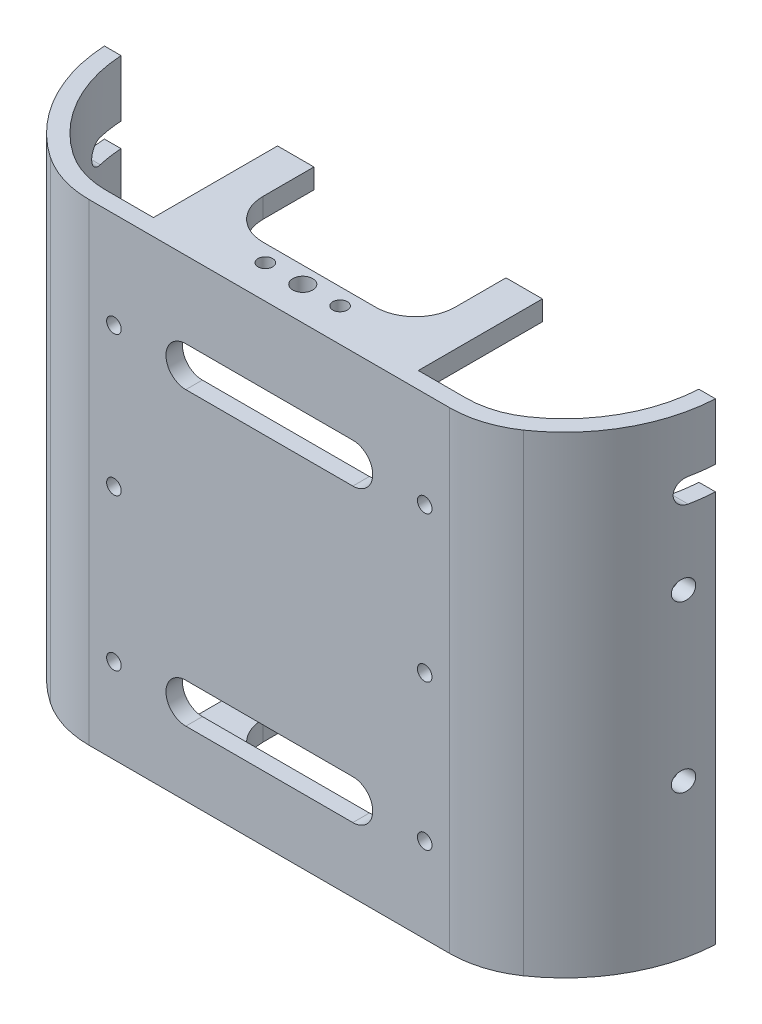
from build123d import *
from build123d.topology import SkipClean

# Parameters (mm, degrees)
EXTRUDE_1_OUTLINE_W          = 93.5
EXTRUDE_1_OUTLINE_H          = 72
EXTRUDE_1_OUTLINE_R          = 1.6
EXTRUDE_1_DEPTH              = 2.5
SKETCH_13_R                  = 4
CUT_EXTRUDE_7_DEPTH          = 1
SKETCH_14_W                  = 93.5
SKETCH_14_H                  = 3
EXTRUDE_4_DEPTH              = 22.5
EXTRUDE_4_2_DEPTH            = 22.5
CUT_EXTRUDE_9_DEPTH          = 1404.749841307
CUT_EXTRUDE_9_DEPTH_BACK     = 1404.749841307
SKETCH_17_R                  = 3.4
EXTRUDE_5_DEPTH              = 3.5
EXTRUDE_5_2_DEPTH            = 3.5
EXTRUDE_5_3_DEPTH            = 3.5
EXTRUDE_5_4_DEPTH            = 3.5
EXTRUDE_5_5_DEPTH            = 3.5
EXTRUDE_5_6_DEPTH            = 3.5
CUT_EXTRUDE_START            = -81.5
CUT_EXTRUDE_11_OUTLINE_R     = 1.5
CUT_EXTRUDE_11_OUTLINE_R_2   = 1.1
CUT_EXTRUDE_11_DEPTH         = 85
FILLET_1_R                   = 15
FILLET_2_R                   = 15
EXTRUDE_START                = -75
EXTRUDE_6_DEPTH              = 75
CUT_EXTRUDE_START_2          = -20
CUT_EXTRUDE_12_OUTLINE_W     = 95
CUT_EXTRUDE_12_OUTLINE_H     = 85
CUT_EXTRUDE_12_DEPTH         = 23.761113625
CUT_EXTRUDE_START_3          = 3.761113625
CUT_EXTRUDE_12_2_OUTLINE_W   = 95
CUT_EXTRUDE_12_2_OUTLINE_H   = 6.849216222
CUT_EXTRUDE_12_2_OUTLINE_H_2 = 6.781336254
CUT_EXTRUDE_12_2_DEPTH       = 21.238886375
SKETCH_25_W                  = 40
SKETCH_25_H                  = 3
EXTRUDE_8_DEPTH              = 18.738886375
CUT_EXTRUDE_13_DEPTH         = 1403.7807385
CUT_EXTRUDE_13_DEPTH_BACK    = 1403.7807385
SKETCH_27_R                  = 1.1
SKETCH_27_R_2                = 1.5
CUT_EXTRUDE_14_DEPTH         = 843.111636683
CUT_EXTRUDE_14_DEPTH_BACK    = 843.111636683
SKETCH_28_R                  = 1.5
SKETCH_29_R                  = 1.1
CUT_EXTRUDE_15_DEPTH         = 10


# Read off the part's stored shape, not the designer's step: 凸台-拉伸1, 切除-拉伸11, 切除-拉伸12
with BuildPart() as part:
    # 凸台-拉伸1 outline → 凸台-拉伸1 (new body)
    with BuildSketch(Plane.XY):
        with Locations((1354.608133016, -704.50677594)):
            Rectangle(EXTRUDE_1_OUTLINE_W, EXTRUDE_1_OUTLINE_H)
        with Locations((1327.358133016, -728.00677594)):
            Circle(EXTRUDE_1_OUTLINE_R, mode=Mode.SUBTRACT)
        with Locations((1328.858133016, -716.50677594)):
            Circle(EXTRUDE_1_OUTLINE_R, mode=Mode.SUBTRACT)
        with Locations((1385.858133016, -728.00677594)):
            Circle(EXTRUDE_1_OUTLINE_R, mode=Mode.SUBTRACT)
        with Locations((1368.858133016, -716.50677594)):
            Circle(EXTRUDE_1_OUTLINE_R, mode=Mode.SUBTRACT)
        with Locations((1328.858133016, -692.50677594)):
            Circle(EXTRUDE_1_OUTLINE_R, mode=Mode.SUBTRACT)
        with Locations((1327.358133016, -679.00677594)):
            Circle(EXTRUDE_1_OUTLINE_R, mode=Mode.SUBTRACT)
        with Locations((1368.858133016, -692.50677594)):
            Circle(EXTRUDE_1_OUTLINE_R, mode=Mode.SUBTRACT)
        with Locations((1385.858133016, -679.00677594)):
            Circle(EXTRUDE_1_OUTLINE_R, mode=Mode.SUBTRACT)
    extrude(amount=EXTRUDE_1_DEPTH)

    # 草图13 → 切除-拉伸7 (cut)
    with BuildSketch(Plane.XY.offset(2.5)):
        with Locations((1368.858133016, -692.50677594)):
            Circle(SKETCH_13_R)
        with Locations((1368.858133016, -716.50677594)):
            Circle(SKETCH_13_R)
        with Locations((1328.858133016, -716.50677594)):
            Circle(SKETCH_13_R)
        with Locations((1328.858133016, -692.50677594)):
            Circle(SKETCH_13_R)
    extrude(amount=-CUT_EXTRUDE_7_DEPTH, mode=Mode.SUBTRACT)

    # 草图15 → 切除-拉伸9 (cut, two sides: drawn at the far end of the back side and taken through both)
    with BuildSketch(Plane.XZ.offset(743.50677594).offset(-CUT_EXTRUDE_9_DEPTH_BACK)):
        with BuildLine():
            Line((1316.26340276, 25), (1300.368331244, 25))
            Line((1300.368331244, 25), (1300.368331244, -20))
            Line((1300.368331244, -20), (1316.26340276, -20))
            ThreePointArc((1316.26340276, -20), (1308.362775025, 2.5), (1316.26340276, 25))
        make_face()
        with BuildLine():
            Line((1408.847934788, -20), (1392.952863272, -20))
            ThreePointArc((1392.952863272, -20), (1400.853491007, 2.5), (1392.952863272, 25))
            Line((1392.952863272, 25), (1408.847934788, 25))
            Line((1408.847934788, 25), (1408.847934788, -20))
        make_face()
    extrude(amount=CUT_EXTRUDE_9_DEPTH + CUT_EXTRUDE_9_DEPTH_BACK, mode=Mode.SUBTRACT)


with BuildPart() as body_2:
    # 草图14 → 凸台-拉伸4 (new, symmetric)
    with BuildSketch(Plane.XY.offset(2.5)):
        with Locations((1354.608133016, -667.00677594)):
            Rectangle(SKETCH_14_W, SKETCH_14_H)
    extrude(amount=EXTRUDE_4_DEPTH, both=True)


with BuildPart() as body_3:
    # 草图14 → Extrude 4 2 (new, symmetric)
    with BuildSketch(Plane.XY.offset(2.5)):
        with Locations((1354.608133016, -742.00677594)):
            Rectangle(SKETCH_14_W, SKETCH_14_H)
    extrude(amount=EXTRUDE_4_2_DEPTH, both=True)


with BuildPart() as body_4:
    # 草图17 → 凸台-拉伸5 (new body)
    with BuildSketch(Plane.XZ.offset(743.50677594)):
        with Locations(Location((1325.39183682, 11.233679486, 0), (0, 0, 270))):
            Circle(SKETCH_17_R)
    extrude_5 = extrude(amount=EXTRUDE_5_DEPTH)


with BuildPart() as body_5:
    # 草图17 → Extrude 5 2 (new body)
    with BuildSketch(Plane.XZ.offset(743.50677594)):
        with Locations(Location((1324.323487379, -6.233679486, 0), (0, 0, 270))):
            Circle(SKETCH_17_R)
    extrude_5_2 = extrude(amount=EXTRUDE_5_2_DEPTH)


with BuildPart() as body_6:
    # 草图17 → Extrude 5 3 (new body)
    with BuildSketch(Plane.XZ.offset(743.50677594)):
        with Locations(Location((1384.892778653, -6.233679486, 0), (0, 0, 90))):
            Circle(SKETCH_17_R)
    extrude_5_3 = extrude(amount=EXTRUDE_5_3_DEPTH)


with BuildPart() as body_7:
    # 草图17 → Extrude 5 4 (new body)
    with BuildSketch(Plane.XZ.offset(743.50677594)):
        with Locations(Location((1383.824429211, 11.233679486, 0), (0, 0, 90))):
            Circle(SKETCH_17_R)
    extrude_5_4 = extrude(amount=EXTRUDE_5_4_DEPTH)


with BuildPart() as body_8:
    # 草图17 → Extrude 5 5 (new body)
    with BuildSketch(Plane.XZ.offset(743.50677594)):
        Polygon((1319.176231823, 6.253844698), (1318.761101754, -0.533471931), (1330.539092376, -1.253844698), (1330.954222445, 5.533471931), align=None)
    extrude_5_5 = extrude(amount=EXTRUDE_5_5_DEPTH)



with BuildPart() as body_9:
    # 草图17 → Extrude 5 6 (new body)
    with BuildSketch(Plane.XZ.offset(743.50677594)):
        Polygon((1378.262043587, 5.533471931), (1378.677173656, -1.253844698), (1390.455164277, -0.533471931), (1390.040034209, 6.253844698), align=None)
    extrude_5_6 = extrude(amount=EXTRUDE_5_6_DEPTH)


with BuildPart() as body_2_1:
    add(body_2.part)

    # 镜向1: 凸台-拉伸5, Extrude 5 2, Extrude 5 3, Extrude 5 4, Extrude 5 5, Extrude 5 6 across plane
    add(extrude_5.mirror(Plane.ZX.offset(-704.50677594)))
    add(extrude_5_2.mirror(Plane.ZX.offset(-704.50677594)))
    add(extrude_5_3.mirror(Plane.ZX.offset(-704.50677594)))
    add(extrude_5_4.mirror(Plane.ZX.offset(-704.50677594)))
    add(extrude_5_5.mirror(Plane.ZX.offset(-704.50677594)))
    add(extrude_5_6.mirror(Plane.ZX.offset(-704.50677594)))


with BuildPart() as cut_extrude_11_tool:
    # 切除-拉伸11 outline → 切除-拉伸11 (new body)
    with BuildSketch(Plane.XZ.offset(743.50677594).offset(CUT_EXTRUDE_START)):
        with Locations((1384.892778653, -6.233679486)):
            Circle(CUT_EXTRUDE_11_OUTLINE_R)
        with Locations((1324.323487378, -6.233679486)):
            Circle(CUT_EXTRUDE_11_OUTLINE_R)
        with Locations((1325.39183682, 11.233679486)):
            Circle(CUT_EXTRUDE_11_OUTLINE_R)
        with Locations((1383.824429211, 11.233679486)):
            Circle(CUT_EXTRUDE_11_OUTLINE_R)
        with BuildLine():
            ThreePointArc((1400.643950739, 0), (1395.799533356, -12.163925891), (1385.310233312, -20))
            Line((1385.310233312, -20), (1401.358133016, -20))
            Line((1401.358133016, -20), (1401.358133016, 25))
            Line((1401.358133016, 25), (1385.310233312, 25))
            ThreePointArc((1385.310233312, 25), (1396.535300347, 16.150796689), (1400.773965105, 2.5))
            ThreePointArc((1400.773965105, 2.5), (1400.741439566, 1.248310768), (1400.643950739, 0))
        make_face()
        with BuildLine():
            Line((1307.858133016, -20), (1323.906032719, -20))
            ThreePointArc((1323.906032719, -20), (1313.416732676, -12.16392589), (1308.572315293, 0))
            ThreePointArc((1308.572315293, 0), (1308.474826466, 1.248310768), (1308.442300927, 2.5))
            ThreePointArc((1308.442300927, 2.5), (1312.680965685, 16.150796689), (1323.906032719, 25))
            Line((1323.906032719, 25), (1307.858133016, 25))
            Line((1307.858133016, 25), (1307.858133016, -20))
        make_face()
        with Locations((1363.730732269, 19.711331032)):
            Circle(CUT_EXTRUDE_11_OUTLINE_R_2)
        with Locations((1345.485533762, 19.711331032)):
            Circle(CUT_EXTRUDE_11_OUTLINE_R_2)
        with BuildLine():
            Line((1360.248281395, 16.648846518), (1348.967984637, 16.648846518))
            ThreePointArc((1348.967984637, 16.648846518), (1343.552817605, 11.233679486), (1348.967984637, 5.818512455))
            Line((1348.967984637, 5.818512455), (1360.248281395, 5.818512455))
            ThreePointArc((1360.248281395, 5.818512455), (1365.663448427, 11.233679486), (1360.248281395, 16.648846518))
        make_face()
    extrude(amount=CUT_EXTRUDE_11_DEPTH)


with BuildPart() as part_1:
    add(part.part)

    # 切除-拉伸11: cut by cut_extrude_11_tool
    add(cut_extrude_11_tool.part, mode=Mode.SUBTRACT)


with BuildPart() as body_2_2:
    add(body_2_1.part)

    # 切除-拉伸11: cut by cut_extrude_11_tool
    add(cut_extrude_11_tool.part, mode=Mode.SUBTRACT)

    # 圆角2
    fillet_2_edges = [body_2_2.edges().sort_by_distance(p)[0] for p in [
        (1385.310233312, -667.00677594, -20),
        (1323.906032719, -667.00677594, -20),
        (1323.906032719, -667.00677594, 25),
        (1385.310233312, -667.00677594, 25),
    ]]
    fillet(fillet_2_edges, radius=FILLET_2_R)


with BuildPart() as body_3_1:
    add(body_3.part)

    # 切除-拉伸11: cut by cut_extrude_11_tool
    add(cut_extrude_11_tool.part, mode=Mode.SUBTRACT)

    # 圆角1
    fillet_1_edges = [body_3_1.edges().sort_by_distance(p)[0] for p in [
        (1385.310233312, -742.00677594, -20),
        (1323.906032719, -742.00677594, -20),
        (1323.906032719, -742.00677594, 25),
        (1385.310233312, -742.00677594, 25),
    ]]
    fillet(fillet_1_edges, radius=FILLET_1_R)


with BuildPart() as body_4_1:
    add(body_4.part)

    # 切除-拉伸11: cut by cut_extrude_11_tool
    add(cut_extrude_11_tool.part, mode=Mode.SUBTRACT)


with BuildPart() as body_5_1:
    add(body_5.part)

    # 切除-拉伸11: cut by cut_extrude_11_tool
    add(cut_extrude_11_tool.part, mode=Mode.SUBTRACT)


with BuildPart() as body_6_1:
    add(body_6.part)

    # 切除-拉伸11: cut by cut_extrude_11_tool
    add(cut_extrude_11_tool.part, mode=Mode.SUBTRACT)


with BuildPart() as body_7_1:
    add(body_7.part)

    # 切除-拉伸11: cut by cut_extrude_11_tool
    add(cut_extrude_11_tool.part, mode=Mode.SUBTRACT)


with BuildPart() as body_8_1:
    with SkipClean():  # the faces are left unmerged after this step: merging them gives an invalid solid
        add(body_8.part)

        add(body_3_1.part)  # 凸台-拉伸6 merges body 3

        add(body_9.part)  # 凸台-拉伸6 merges body 9

        add(part_1.part)  # 凸台-拉伸6 merges part

        add(body_7_1.part)  # 凸台-拉伸6 merges body 7

        add(body_4_1.part)  # 凸台-拉伸6 merges body 4

        add(body_5_1.part)  # 凸台-拉伸6 merges body 5

        add(body_6_1.part)  # 凸台-拉伸6 merges body 6

        add(body_2_2.part)  # 凸台-拉伸6 merges body 2
        # 草图22 → 凸台-拉伸6 (add)
        with BuildSketch(Plane.XZ.offset(743.50677594).offset(EXTRUDE_START)):
            with BuildLine():
                Line((1381.828226626, 25), (1327.388039406, 25))
                ThreePointArc((1327.388039406, 25), (1322.939612989, 24.325205144), (1318.891423274, 22.361533655))
                ThreePointArc((1318.891423274, 22.361533655), (1308.442300927, 2.5), (1318.891423274, -17.361533655))
                ThreePointArc((1318.891423274, -17.361533655), (1322.939612989, -19.325205144), (1327.388039406, -20))
                Line((1327.388039406, -20), (1381.828226626, -20))
                ThreePointArc((1381.828226626, -20), (1386.276653043, -19.325205144), (1390.324842758, -17.361533655))
                ThreePointArc((1390.324842758, -17.361533655), (1400.773965105, 2.5), (1390.324842758, 22.361533655))
                ThreePointArc((1390.324842758, 22.361533655), (1386.276653043, 24.325205144), (1381.828226626, 25))
            make_face()
            with BuildLine():
                Line((1327.388039406, -17.5), (1381.828226626, -17.5))
                ThreePointArc((1381.828226626, -17.5), (1385.53524864, -16.937670953), (1388.908740069, -15.301278046))
                ThreePointArc((1388.908740069, -15.301278046), (1398.273965105, 2.5), (1388.908740069, 20.301278046))
                ThreePointArc((1388.908740069, 20.301278046), (1385.53524864, 21.937670953), (1381.828226626, 22.5))
                Line((1381.828226626, 22.5), (1327.388039406, 22.5))
                ThreePointArc((1327.388039406, 22.5), (1323.681017392, 21.937670953), (1320.307525963, 20.301278046))
                ThreePointArc((1320.307525963, 20.301278046), (1310.942300927, 2.5), (1320.307525963, -15.301278046))
                ThreePointArc((1320.307525963, -15.301278046), (1323.681017392, -16.937670953), (1327.388039406, -17.5))
            make_face(mode=Mode.SUBTRACT)
        extrude(amount=EXTRUDE_6_DEPTH)
    add(body_8_1.part.scale(1), mode=Mode.REPLACE)  # the faces are merged on a copy

    # 切除-拉伸12 outline → 切除-拉伸12 (cut)
    with BuildSketch(Plane.XY.offset(CUT_EXTRUDE_START_2)):
        with Locations((1354.5, -704.50677594)):
            Rectangle(CUT_EXTRUDE_12_OUTLINE_W, CUT_EXTRUDE_12_OUTLINE_H)
    extrude(amount=CUT_EXTRUDE_12_DEPTH, mode=Mode.SUBTRACT)

    # Cut-Extrude 12 2 outline → Cut-Extrude 12 2 (cut)
    with BuildSketch(Plane.XY.offset(CUT_EXTRUDE_START_3)):
        with Locations((1354.5, -665.431384051)):
            Rectangle(CUT_EXTRUDE_12_2_OUTLINE_W, CUT_EXTRUDE_12_2_OUTLINE_H)
        with Locations((1354.5, -743.616107813)):
            Rectangle(CUT_EXTRUDE_12_2_OUTLINE_W, CUT_EXTRUDE_12_2_OUTLINE_H_2)
    extrude(amount=CUT_EXTRUDE_12_2_DEPTH, mode=Mode.SUBTRACT)

    # 草图25 → 凸台-拉伸8 (add)
    with BuildSketch(Plane(origin=(0, 0, 22.5), x_dir=(-1, 0, 0), z_dir=(0, 0, -1))):
        with Locations((-1354.608133016, -670.355992162)):
            Rectangle(SKETCH_25_W, SKETCH_25_H)
        with Locations((-1354.608133016, -738.725439686)):
            Rectangle(SKETCH_25_W, SKETCH_25_H)
    extrude(amount=EXTRUDE_8_DEPTH)

    # 草图27 → 切除-拉伸13 (cut, two sides: drawn at the far end of the back side and taken through both)
    with BuildSketch(Plane.XZ.offset(740.225439686).offset(-CUT_EXTRUDE_13_DEPTH_BACK)):
        with Locations(Location((1348.962530521, 19.951746987, 0), (0, 0, 270))):
            Circle(SKETCH_27_R)
        with Locations(Location((1360.253735511, 19.951746987, 0), (0, 0, 270))):
            Circle(SKETCH_27_R)
        with Locations(Location((1354.608133016, 19.951746987, 0), (0, 0, 270))):
            Circle(SKETCH_27_R_2)
        with BuildLine():
            Line((1340.108133016, 11.442209947), (1340.108133016, -2.547799197))
            Line((1340.108133016, -2.547799197), (1369.108133016, -2.547799197))
            Line((1369.108133016, -2.547799197), (1369.108133016, 11.442209947))
            ThreePointArc((1369.108133016, 11.442209947), (1367.350773703, 15.684850635), (1363.108133016, 17.442209947))
            Line((1363.108133016, 17.442209947), (1346.108133016, 17.442209947))
            ThreePointArc((1346.108133016, 17.442209947), (1341.865492329, 15.684850635), (1340.108133016, 11.442209947))
        make_face()
    extrude(amount=CUT_EXTRUDE_13_DEPTH + CUT_EXTRUDE_13_DEPTH_BACK, mode=Mode.SUBTRACT)

    # 草图28 → 切除-拉伸14 (cut, two sides: drawn at the far end of the back side and taken through both)
    with BuildSketch(Plane(origin=(1000, 0, 0), x_dir=(0, 0, -1), z_dir=(1, 0, 0)).offset(-CUT_EXTRUDE_14_DEPTH_BACK)):
        with Locations(Location((-7.949787989, -692.040715924, 0), (0, 0, 180))):
            Circle(SKETCH_28_R)
        with Locations(Location((-7.949787989, -717.040715924, 0), (0, 0, 180))):
            Circle(SKETCH_28_R)
        with BuildLine():
            Line((-7.430599737, -677.424837089), (-0.305866587, -677.424837089))
            ThreePointArc((-0.305866587, -677.424837089), (1.494890143, -679.22559382), (-0.305866587, -681.02635055))
            Line((-0.305866587, -681.02635055), (-7.430599737, -681.02635055))
            ThreePointArc((-7.430599737, -681.02635055), (-9.231356467, -679.22559382), (-7.430599737, -677.424837089))
        make_face()
    extrude(amount=CUT_EXTRUDE_14_DEPTH + CUT_EXTRUDE_14_DEPTH_BACK, mode=Mode.SUBTRACT)

    # 草图29 → 切除-拉伸15 (cut)
    with BuildSketch(Plane.XY.offset(25)):
        with Locations((1331.143947461, -727.415176454)):
            Circle(SKETCH_29_R)
        with Locations((1331.143947461, -704.50677594)):
            Circle(SKETCH_29_R)
        with Locations((1331.143947461, -683.409824666)):
            Circle(SKETCH_29_R)
        with Locations((1378.072318571, -683.409824666)):
            Circle(SKETCH_29_R)
        with Locations((1378.072318571, -705.41250056)):
            Circle(SKETCH_29_R)
        with Locations((1378.072318571, -727.415176454)):
            Circle(SKETCH_29_R)
        with BuildLine():
            Line((1341.997675033, -680.409824666), (1367.218590999, -680.409824666))
            ThreePointArc((1367.218590999, -680.409824666), (1370.218590999, -683.409824666), (1367.218590999, -686.409824666))
            Line((1367.218590999, -686.409824666), (1341.997675033, -686.409824666))
            ThreePointArc((1341.997675033, -686.409824666), (1338.997675033, -683.409824666), (1341.997675033, -680.409824666))
        make_face()
        with BuildLine():
            Line((1341.997675033, -724.415176454), (1367.218590999, -724.415176454))
            ThreePointArc((1367.218590999, -724.415176454), (1370.218590999, -727.415176454), (1367.218590999, -730.415176454))
            Line((1367.218590999, -730.415176454), (1341.997675033, -730.415176454))
            ThreePointArc((1341.997675033, -730.415176454), (1338.997675033, -727.415176454), (1341.997675033, -724.415176454))
        make_face()
    extrude(amount=-CUT_EXTRUDE_15_DEPTH, mode=Mode.SUBTRACT)


solid = body_8_1.part
